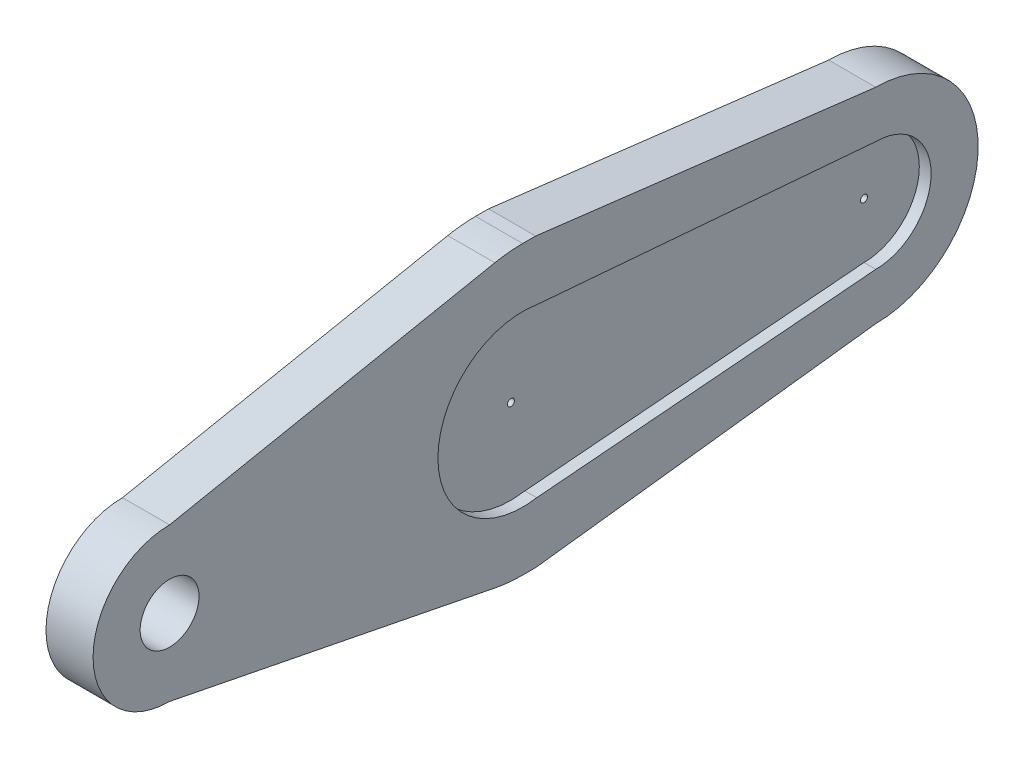
from build123d import *

# Parameters (mm, degrees)
SKETCH2_R           = 1.25
BOSS_EXTRUDE1_DEPTH = 2
BOSS_EXTRUDE2_DEPTH = 1.5
SKETCH3_R           = 0.15
CUT_EXTRUDE1_DEPTH  = 20.821705275


with BuildPart() as part:
    # Sketch2 → Boss-Extrude1 (new body)
    with BuildSketch(Plane.YZ):
        with BuildLine():
            ThreePointArc((-4.35, -14.45), (-3.075914484, -17.525914513), (4.1e-08, -18.8))
            ThreePointArc((4.1e-08, -18.8), (3.075914513, -17.525914484), (4.35, -14.45))
            Line((4.35, -14.45), (6.1, 0))
            Line((6.1, 0), (6.1, 0.55))
            ThreePointArc((6.1, 0.55), (6.070921356, 1.144906627), (5.983962658, 1.734141424))
            Line((5.983962658, 1.734141424), (3.25, 15.55))
            ThreePointArc((3.25, 15.55), (2.298097039, 17.848097039), (0, 18.8))
            ThreePointArc((0, 18.8), (-2.298097039, 17.848097039), (-3.25, 15.55))
            Line((-3.25, 15.55), (-5.983962658, 1.734141424))
            ThreePointArc((-5.983962658, 1.734141424), (-6.070921356, 1.144906627), (-6.1, 0.55))
            Line((-6.1, 0.55), (-6.1, 0))
            Line((-6.1, 0), (-4.35, -14.45))
        make_face()
        with BuildLine():
            Line((3.550344828, -0.045862069), (2.35, -14.45))
            ThreePointArc((2.35, -14.45), (0, -16.8), (-2.35, -14.45))
            Line((-2.35, -14.45), (-3.550344828, -0.045862069))
            ThreePointArc((-3.550344828, -0.045862069), (-3.58756473, 0.251036273), (-3.6, 0.55))
            ThreePointArc((-3.6, 0.55), (0, 4.15), (3.6, 0.55))
            ThreePointArc((3.6, 0.55), (3.58756473, 0.251036273), (3.550344828, -0.045862069))
        make_face(mode=Mode.SUBTRACT)
        with Locations((0, 15.55)):
            Circle(SKETCH2_R, mode=Mode.SUBTRACT)
    extrude(amount=BOSS_EXTRUDE1_DEPTH)

    # Sketch2<3> → Boss-Extrude2 (add)
    with BuildSketch(Plane.YZ):
        with BuildLine():
            ThreePointArc((-2.35, -14.45), (0, -16.8), (2.35, -14.45))
            Line((2.35, -14.45), (3.550344828, -0.045862069))
            Line((3.550344828, -0.045862069), (3.6, 0.55))
            ThreePointArc((3.6, 0.55), (0, 4.15), (-3.6, 0.55))
            Line((-3.6, 0.55), (-3.550344828, -0.045862069))
            Line((-3.550344828, -0.045862069), (-2.35, -14.45))
        make_face()
    extrude(amount=BOSS_EXTRUDE2_DEPTH)

    # Sketch3 → Cut-Extrude1 (cut, through all)
    with BuildSketch(Plane.YZ.offset(1.5)):
        with Locations((0, 0.55)):
            Circle(SKETCH3_R)
        with Locations((0, -14.45)):
            Circle(SKETCH3_R)
    extrude(amount=-CUT_EXTRUDE1_DEPTH, mode=Mode.SUBTRACT)


solid = part.part
